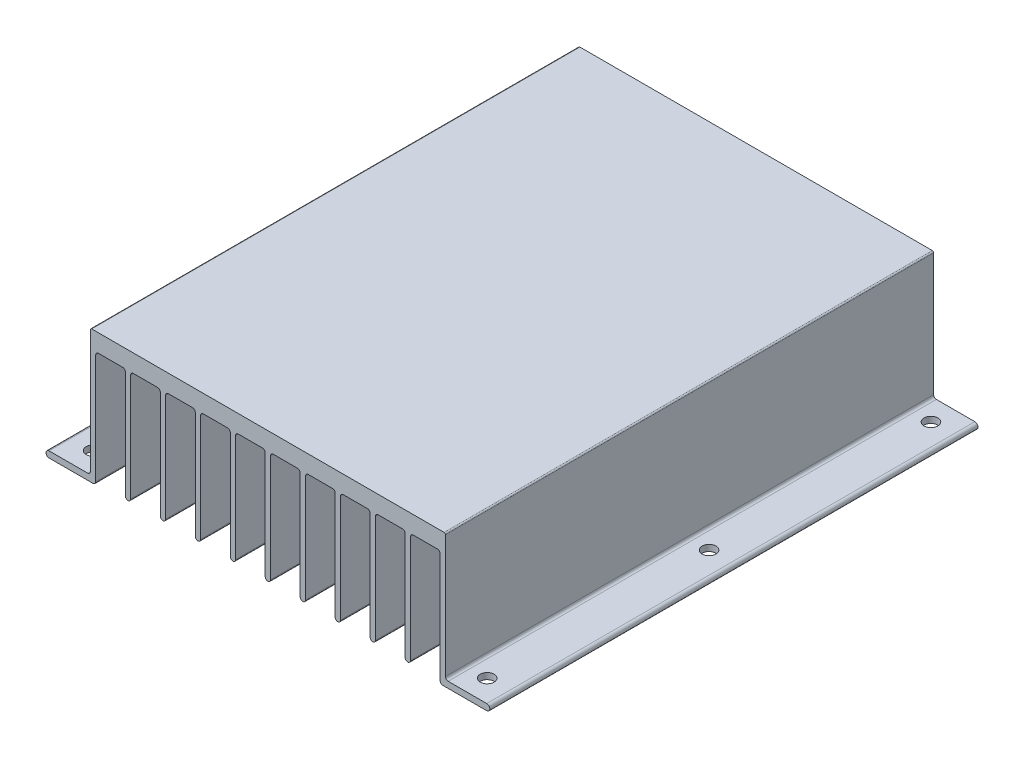
from build123d import *

# Parameters (mm, degrees)
BOSS_EXTRUDE1_DEPTH                 = 139.7
F_5_32_0_15625_DIAMETER_HOLE1_D     = 3.96875
F_5_32_0_15625_DIAMETER_HOLE1_DEPTH = 38.100461051
FILLET1_R                           = 0.381
FILLET2_R                           = 0.7874


with BuildPart() as part:
    # Sketch1 → Boss-Extrude1 (new body)
    with BuildSketch(Plane.XY):
        with BuildLine():
            Line((62.610769474, -36.322), (50.8, -36.322))
            Line((50.8, -36.322), (50.8, 0))
            Line((50.8, 0), (-50.8, 0))
            Line((-50.8, 0), (-50.8, -36.322))
            Line((-50.8, -36.322), (-62.610769474, -36.322))
            ThreePointArc((-62.610769474, -36.322), (-63.5, -37.211230526), (-62.610769474, -38.100461051))
            Line((-62.610769474, -38.100461051), (-49.276, -38.100461051))
            Line((-49.276, -38.100461051), (-49.276, -5.080461051))
            Line((-49.276, -5.080461051), (-40.7924, -5.080461051))
            Line((-40.7924, -5.080461051), (-40.7924, -36.576461051))
            ThreePointArc((-40.7924, -36.576461051), (-40.0304, -37.338461051), (-39.2684, -36.576461051))
            Line((-39.2684, -36.576461051), (-39.2684, -5.080461051))
            Line((-39.2684, -5.080461051), (-30.7848, -5.080461051))
            Line((-30.7848, -5.080461051), (-30.7848, -36.576461051))
            ThreePointArc((-30.7848, -36.576461051), (-30.0228, -37.338461051), (-29.2608, -36.576461051))
            Line((-29.2608, -36.576461051), (-29.2608, -5.080461051))
            Line((-29.2608, -5.080461051), (-20.7772, -5.080461051))
            Line((-20.7772, -5.080461051), (-20.7772, -36.576461051))
            ThreePointArc((-20.7772, -36.576461051), (-20.0152, -37.338461051), (-19.2532, -36.576461051))
            Line((-19.2532, -36.576461051), (-19.2532, -5.080461051))
            Line((-19.2532, -5.080461051), (-10.7696, -5.080461051))
            Line((-10.7696, -5.080461051), (-10.7696, -36.576461051))
            ThreePointArc((-10.7696, -36.576461051), (-10.0076, -37.338461051), (-9.2456, -36.576461051))
            Line((-9.2456, -36.576461051), (-9.2456, -5.080461051))
            Line((-9.2456, -5.080461051), (-0.762, -5.080461051))
            Line((-0.762, -5.080461051), (-0.762, -36.576461051))
            ThreePointArc((-0.762, -36.576461051), (0, -37.338461051), (0.762, -36.576461051))
            Line((0.762, -36.576461051), (0.762, -5.080461051))
            Line((0.762, -5.080461051), (9.2456, -5.080461051))
            Line((9.2456, -5.080461051), (9.2456, -36.576461051))
            ThreePointArc((9.2456, -36.576461051), (10.0076, -37.338461051), (10.7696, -36.576461051))
            Line((10.7696, -36.576461051), (10.7696, -5.080461051))
            Line((10.7696, -5.080461051), (19.2532, -5.080461051))
            Line((19.2532, -5.080461051), (19.2532, -36.576461051))
            ThreePointArc((19.2532, -36.576461051), (20.0152, -37.338461051), (20.7772, -36.576461051))
            Line((20.7772, -36.576461051), (20.7772, -5.080461051))
            Line((20.7772, -5.080461051), (29.2608, -5.080461051))
            Line((29.2608, -5.080461051), (29.2608, -36.576461051))
            ThreePointArc((29.2608, -36.576461051), (30.0228, -37.338461051), (30.7848, -36.576461051))
            Line((30.7848, -36.576461051), (30.7848, -5.080461051))
            Line((30.7848, -5.080461051), (39.2684, -5.080461051))
            Line((39.2684, -5.080461051), (39.2684, -36.576461051))
            ThreePointArc((39.2684, -36.576461051), (40.0304, -37.338461051), (40.7924, -36.576461051))
            Line((40.7924, -36.576461051), (40.7924, -5.080461051))
            Line((40.7924, -5.080461051), (49.276, -5.080461051))
            Line((49.276, -5.080461051), (49.276, -38.100461051))
            Line((49.276, -38.100461051), (62.610769474, -38.100461051))
            ThreePointArc((62.610769474, -38.100461051), (63.5, -37.211230526), (62.610769474, -36.322))
        make_face()
    extrude(amount=-BOSS_EXTRUDE1_DEPTH)

    # 5/32 (0.15625) Diameter Hole1
    with Locations(Plane(origin=(0, -38.100461051, 0), x_dir=(-1, 0, 0), z_dir=(0, -1, 0))):
        with Locations((56.388, 6.35), (56.388, 69.85), (56.388, 133.35), (-56.388, 6.35), (-56.388, 69.85), (-56.388, 133.35)):
            Hole(F_5_32_0_15625_DIAMETER_HOLE1_D / 2, depth=F_5_32_0_15625_DIAMETER_HOLE1_DEPTH)

    # Fillet1
    fillet1_edges = [part.edges().sort_by_distance(p)[0] for p in [
        (-50.8, 0, -69.85),
        (50.8, 0, -69.85),
    ]]
    fillet(fillet1_edges, radius=FILLET1_R)

    # Fillet2
    fillet2_edges = [part.edges().sort_by_distance(p)[0] for p in [
        (20.7772, -5.080461051, -69.85),
        (-50.8, -36.322, -69.85),
        (40.7924, -5.080461051, -69.85),
        (-49.276, -5.080461051, -69.85),
        (10.7696, -5.080461051, -69.85),
        (-40.7924, -5.080461051, -69.85),
        (30.7848, -5.080461051, -69.85),
        (-39.2684, -5.080461051, -69.85),
        (49.276, -38.100461051, -69.85),
        (-30.7848, -5.080461051, -69.85),
        (-49.276, -38.100461051, -69.85),
        (-29.2608, -5.080461051, -69.85),
        (19.2532, -5.080461051, -69.85),
        (-20.7772, -5.080461051, -69.85),
        (29.2608, -5.080461051, -69.85),
        (-19.2532, -5.080461051, -69.85),
        (39.2684, -5.080461051, -69.85),
        (-10.7696, -5.080461051, -69.85),
        (49.276, -5.080461051, -69.85),
        (-9.2456, -5.080461051, -69.85),
        (50.8, -36.322, -69.85),
        (-0.762, -5.080461051, -69.85),
        (0.762, -5.080461051, -69.85),
        (9.2456, -5.080461051, -69.85),
    ]]
    fillet(fillet2_edges, radius=FILLET2_R)


solid = part.part
